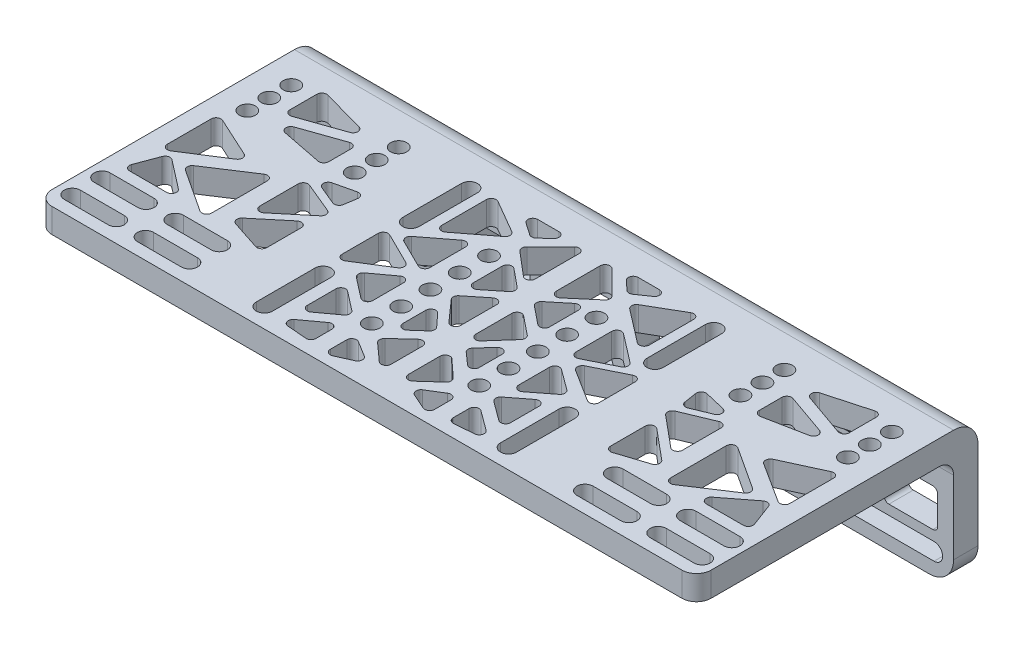
from build123d import *

# Parameters (mm, degrees)
SKETCH_1_W             = 135
SKETCH_1_H             = 70
EXTRUDE_1_DEPTH        = 5
CUT_EXTRUDE_1_DEPTH    = 77.198753271
CUT_EXTRUDE_2_DEPTH    = 77.198753271
SKETCH_4_R             = 1.65
CUT_EXTRUDE_3_DEPTH    = 77.198753271
CUT_EXTRUDE_8_DEPTH    = 77.198753271
CUT_EXTRUDE_9_DEPTH    = 77.198753271
SKETCH_14_R            = 1.65
CUT_EXTRUDE_11_DEPTH   = 77.198753271
CUT_EXTRUDE_12_DEPTH   = 77.198753271
FILLET_1_R             = 3
SKETCH_16_W            = 135
SKETCH_16_H            = 5
EXTRUDE_2_DEPTH        = 23
SKETCH_17_W            = 135
SKETCH_17_H            = 12.35
CUT_EXTRUDE_13_DEPTH   = 80.437082021
FILLET_2_R             = 5
RIB_3_REACH            = 81.437
SKETCH_19_WALL_W       = 168.684413718
SKETCH_19_WALL_H       = 2
PATTERN_LINEAR_1_COUNT = 3
PATTERN_LINEAR_1_PITCH = 23
PATTERN_LINEAR_2_COUNT = 3
PATTERN_LINEAR_2_PITCH = 23
CUT_EXTRUDE_14_DEPTH   = 92.699359322
FILLET_4_R             = 5
FILLET_5_R             = 3
CUT_EXTRUDE_17_DEPTH   = 92.699359322


with BuildPart() as part:
    # 草图1 → 凸台-拉伸1 (new body)
    with BuildSketch(Plane(origin=(0, 0, 0), x_dir=(1, 0, 0), z_dir=(0, 1, 0))):
        Rectangle(SKETCH_1_W, SKETCH_1_H)
    extrude(amount=EXTRUDE_1_DEPTH)

    # 草图2 → 切除-拉伸1 (cut, through all)
    with BuildSketch(Plane(origin=(0, 5, 0), x_dir=(1, 0, 0), z_dir=(0, 1, 0))):
        with BuildLine():
            Line((-64.5, -29.2), (-55.5, -29.2))
            ThreePointArc((-55.5, -29.2), (-53.85, -30.85), (-55.5, -32.5))
            Line((-55.5, -32.5), (-64.5, -32.5))
            ThreePointArc((-64.5, -32.5), (-66.15, -30.85), (-64.5, -29.2))
        make_face()
        with BuildLine():
            Line((-64.5, -23.1), (-55.5, -23.1))
            ThreePointArc((-55.5, -23.1), (-53.85, -24.75), (-55.5, -26.4))
            Line((-55.5, -26.4), (-64.5, -26.4))
            ThreePointArc((-64.5, -26.4), (-66.15, -24.75), (-64.5, -23.1))
        make_face()
        with BuildLine():
            Line((64.5, -29.2), (55.5, -29.2))
            ThreePointArc((55.5, -29.2), (53.85, -30.85), (55.5, -32.5))
            Line((55.5, -32.5), (64.5, -32.5))
            ThreePointArc((64.5, -32.5), (66.15, -30.85), (64.5, -29.2))
        make_face()
        with BuildLine():
            Line((64.5, -23.1), (55.5, -23.1))
            ThreePointArc((55.5, -23.1), (53.85, -24.75), (55.5, -26.4))
            Line((55.5, -26.4), (64.5, -26.4))
            ThreePointArc((64.5, -26.4), (66.15, -24.75), (64.5, -23.1))
        make_face()
        with BuildLine():
            Line((-40.5, -29.2), (-49.5, -29.2))
            ThreePointArc((-49.5, -29.2), (-51.15, -30.85), (-49.5, -32.5))
            Line((-49.5, -32.5), (-40.5, -32.5))
            ThreePointArc((-40.5, -32.5), (-38.85, -30.85), (-40.5, -29.2))
        make_face()
        with BuildLine():
            Line((-40.5, -23.1), (-49.5, -23.1))
            ThreePointArc((-49.5, -23.1), (-51.15, -24.75), (-49.5, -26.4))
            Line((-49.5, -26.4), (-40.5, -26.4))
            ThreePointArc((-40.5, -26.4), (-38.85, -24.75), (-40.5, -23.1))
        make_face()
        with BuildLine():
            Line((40.5, -29.2), (49.5, -29.2))
            ThreePointArc((49.5, -29.2), (51.15, -30.85), (49.5, -32.5))
            Line((49.5, -32.5), (40.5, -32.5))
            ThreePointArc((40.5, -32.5), (38.85, -30.85), (40.5, -29.2))
        make_face()
        with BuildLine():
            Line((40.5, -23.1), (49.5, -23.1))
            ThreePointArc((49.5, -23.1), (51.15, -24.75), (49.5, -26.4))
            Line((49.5, -26.4), (40.5, -26.4))
            ThreePointArc((40.5, -26.4), (38.85, -24.75), (40.5, -23.1))
        make_face()
    extrude(amount=-CUT_EXTRUDE_1_DEPTH, mode=Mode.SUBTRACT)

    # 草图3 → 切除-拉伸2 (cut, through all)
    with BuildSketch(Plane(origin=(0, 5, 0), x_dir=(1, 0, 0), z_dir=(0, 1, 0))):
        with BuildLine():
            Line((-23.35, 11), (-23.35, -1))
            ThreePointArc((-23.35, -1), (-25, -2.65), (-26.65, -1))
            Line((-26.65, -1), (-26.65, 11))
            ThreePointArc((-26.65, 11), (-25, 12.65), (-23.35, 11))
        make_face()
        with BuildLine():
            Line((23.35, 11), (23.35, -1))
            ThreePointArc((23.35, -1), (25, -2.65), (26.65, -1))
            Line((26.65, -1), (26.65, 11))
            ThreePointArc((26.65, 11), (25, 12.65), (23.35, 11))
        make_face()
        with BuildLine():
            Line((-23.35, -19), (-23.35, -31))
            ThreePointArc((-23.35, -31), (-25, -32.65), (-26.65, -31))
            Line((-26.65, -31), (-26.65, -19))
            ThreePointArc((-26.65, -19), (-25, -17.35), (-23.35, -19))
        make_face()
        with BuildLine():
            Line((23.35, -19), (23.35, -31))
            ThreePointArc((23.35, -31), (25, -32.65), (26.65, -31))
            Line((26.65, -31), (26.65, -19))
            ThreePointArc((26.65, -19), (25, -17.35), (23.35, -19))
        make_face()
    extrude(amount=-CUT_EXTRUDE_2_DEPTH, mode=Mode.SUBTRACT)

    # 草图4 → 切除-拉伸3 (cut, through all)
    with BuildSketch(Plane(origin=(0, 5, 0), x_dir=(1, 0, 0), z_dir=(0, 1, 0))):
        with Locations((-11, 1)):
            Circle(SKETCH_4_R)
        with Locations((11, 1)):
            Circle(SKETCH_4_R)
        with Locations((-11, -5)):
            Circle(SKETCH_4_R)
        with Locations((11, -5)):
            Circle(SKETCH_4_R)
        with Locations((-11, -11)):
            Circle(SKETCH_4_R)
        with Locations((11, -11)):
            Circle(SKETCH_4_R)
        with Locations((-11, -17)):
            Circle(SKETCH_4_R)
        with Locations((11, -17)):
            Circle(SKETCH_4_R)
        with Locations((-11, -23)):
            Circle(SKETCH_4_R)
        with Locations((11, -23)):
            Circle(SKETCH_4_R)
    extrude(amount=-CUT_EXTRUDE_3_DEPTH, mode=Mode.SUBTRACT)

    # 草图12 → 切除-拉伸8 (cut, through all)
    with BuildSketch(Plane(origin=(0, 5, 0), x_dir=(1, 0, 0), z_dir=(0, 1, 0))):
        with BuildLine():
            Line((-63.734074102, -3.168348006), (-63.734074102, -12.14560188))
            ThreePointArc((-63.734074102, -12.14560188), (-63.21431058, -13.022740937), (-62.195328252, -12.988070223))
            Line((-62.195328252, -12.988070223), (-54.02462453, -7.763027929))
            ThreePointArc((-54.02462453, -7.763027929), (-53.565765363, -6.851391459), (-54.146044292, -6.011802778))
            Line((-54.146044292, -6.011802778), (-62.316748014, -2.259591197))
            ThreePointArc((-62.316748014, -2.259591197), (-63.273830488, -2.32652674), (-63.734074102, -3.168348006))
        make_face()
        with BuildLine():
            Line((-57.235078223, -13.25409941), (-48.532404413, -7.570519551))
            ThreePointArc((-48.532404413, -7.570519551), (-47.509578035, -7.528348866), (-46.985601953, -8.4077812))
            Line((-46.985601953, -8.4077812), (-46.985601953, -19.824018357))
            ThreePointArc((-46.985601953, -19.824018357), (-47.511312771, -20.704387468), (-48.535701497, -20.659117448))
            Line((-48.535701497, -20.659117448), (-57.238375307, -14.926460151))
            ThreePointArc((-57.238375307, -14.926460151), (-57.68827382, -14.089389549), (-57.235078223, -13.25409941))
        make_face()
        with BuildLine():
            Line((-60.531869256, -14.412045599), (-54.642348672, -18.971490406))
            ThreePointArc((-54.642348672, -18.971490406), (-54.308267633, -20.085695031), (-55.254506416, -20.762226074))
            Line((-55.254506416, -20.762226074), (-62.853164133, -20.762226074))
            ThreePointArc((-62.853164133, -20.762226074), (-63.675053896, -20.331872646), (-63.789537506, -19.411220509))
            Line((-63.789537506, -19.411220509), (-62.080400373, -14.851775702))
            ThreePointArc((-62.080400373, -14.851775702), (-61.417192855, -14.240814315), (-60.531869256, -14.412045599))
        make_face()
        with BuildLine():
            Line((-43.29797533, -5.780567657), (-43.29797533, -13.662208286))
            ThreePointArc((-43.29797533, -13.662208286), (-42.722215702, -14.567757902), (-41.657935117, -14.430549698))
            Line((-41.657935117, -14.430549698), (-35.350215945, -9.176122612))
            ThreePointArc((-35.350215945, -9.176122612), (-35.001477233, -8.258395003), (-35.605765824, -7.484652183))
            Line((-35.605765824, -7.484652183), (-41.913484996, -4.85743864))
            ThreePointArc((-41.913484996, -4.85743864), (-42.852731883, -4.948554937), (-43.29797533, -5.780567657))
        make_face()
        with BuildLine():
            Line((-40.194472515, -4.039861777), (-36.374746493, -5.630807039))
            ThreePointArc((-36.374746493, -5.630807039), (-35.502130215, -5.580451224), (-35.002439657, -4.863301153))
            Line((-35.002439657, -4.863301153), (-34.594757613, -2.275542844))
            ThreePointArc((-34.594757613, -2.275542844), (-34.902588219, -1.386694522), (-35.812077839, -1.14661193))
            Line((-35.812077839, -1.14661193), (-40.039485904, -2.143424976))
            ThreePointArc((-40.039485904, -2.143424976), (-40.806659314, -3.035279156), (-40.194472515, -4.039861777))
        make_face()
        with BuildLine():
            Line((-42.939836308, -17.557072792), (-36.840451839, -12.476191717))
            ThreePointArc((-36.840451839, -12.476191717), (-35.776171254, -12.338983513), (-35.200411626, -13.244533129))
            Line((-35.200411626, -13.244533129), (-35.200411626, -20.314431761))
            ThreePointArc((-35.200411626, -20.314431761), (-35.613058655, -21.12376265), (-36.510444601, -21.265157565))
            Line((-36.510444601, -21.265157565), (-42.60982907, -19.276140007))
            ThreePointArc((-42.60982907, -19.276140007), (-43.281864213, -18.513940623), (-42.939836308, -17.557072792))
        make_face()
    cut_extrude_8 = extrude(amount=-CUT_EXTRUDE_8_DEPTH, mode=Mode.SUBTRACT)

    # 草图13 → 切除-拉伸9 (cut, through all)
    with BuildSketch(Plane(origin=(0, 5, 0), x_dir=(1, 0, 0), z_dir=(0, 1, 0))):
        with BuildLine():
            Line((-26.32841963, -6.356579512), (-26.32841963, -13.778151031))
            ThreePointArc((-26.32841963, -13.778151031), (-25.811643201, -14.653648022), (-24.795429669, -14.624272595))
            Line((-24.795429669, -14.624272595), (-18.204243774, -10.472344473))
            ThreePointArc((-18.204243774, -10.472344473), (-17.738524726, -9.575426115), (-18.292843888, -8.730389407))
            Line((-18.292843888, -8.730389407), (-24.884029783, -5.46074601))
            ThreePointArc((-24.884029783, -5.46074601), (-25.855491804, -5.506758988), (-26.32841963, -6.356579512))
        make_face()
        with BuildLine():
            Line((-22.215274528, -5.18562129), (-16.406548914, -8.067115098))
            ThreePointArc((-16.406548914, -8.067115098), (-15.435086893, -8.02110212), (-14.962159067, -7.171281596))
            Line((-14.962159067, -7.171281596), (-14.962159067, 0.175289238))
            ThreePointArc((-14.962159067, 0.175289238), (-15.520253308, 1.072350719), (-16.571597668, 0.968122506))
            Line((-16.571597668, 0.968122506), (-22.380323281, -3.496954519))
            ThreePointArc((-22.380323281, -3.496954519), (-22.766142167, -4.387063349), (-22.215274528, -5.18562129))
        make_face()
        with BuildLine():
            Line((-19.634017925, 0.752073679), (-12.851890732, 5.965389358))
            ThreePointArc((-12.851890732, 5.965389358), (-12.463407657, 6.822661193), (-12.95891763, 7.622851148))
            Line((-12.95891763, 7.622851148), (-19.741044823, 11.563757538))
            ThreePointArc((-19.741044823, 11.563757538), (-20.742249217, 11.565850339), (-21.243456526, 10.699129016))
            Line((-21.243456526, 10.699129016), (-21.243456526, 1.544906947))
            ThreePointArc((-21.243456526, 1.544906947), (-20.685362284, 0.647845467), (-19.634017925, 0.752073679))
        make_face()
        with BuildLine():
            Line((-20.745433527, -14.806594091), (-16.554551135, -11.725049957))
            ThreePointArc((-16.554551135, -11.725049957), (-15.510712541, -11.638401604), (-14.962159067, -12.53069978))
            Line((-14.962159067, -12.53069978), (-14.962159067, -18.8711078))
            ThreePointArc((-14.962159067, -18.8711078), (-15.522760117, -19.769399825), (-16.576016193, -19.660524944))
            Line((-16.576016193, -19.660524944), (-20.766898585, -16.401661059))
            ThreePointArc((-20.766898585, -16.401661059), (-21.152950924, -15.598787981), (-20.745433527, -14.806594091))
        make_face()
        with BuildLine():
            Line((-19.202554479, -19.757164414), (-15.332427174, -22.766606561))
            ThreePointArc((-15.332427174, -22.766606561), (-14.946374836, -23.569479639), (-15.353892232, -24.361673529))
            Line((-15.353892232, -24.361673529), (-19.224019538, -27.207367343))
            ThreePointArc((-19.224019538, -27.207367343), (-20.267858132, -27.294015695), (-20.816411606, -26.40171752))
            Line((-20.816411606, -26.40171752), (-20.816411606, -20.546581558))
            ThreePointArc((-20.816411606, -20.546581558), (-20.255810555, -19.648289533), (-19.202554479, -19.757164414))
        make_face()
        with BuildLine():
            Line((-19.659893025, -30.254964755), (-15.649320454, -27.306001929))
            ThreePointArc((-15.649320454, -27.306001929), (-14.60548186, -27.219353576), (-14.056928386, -28.111651752))
            Line((-14.056928386, -28.111651752), (-14.056928386, -31.393281697))
            ThreePointArc((-14.056928386, -31.393281697), (-14.379677934, -32.129034254), (-15.139592036, -32.3898592))
            Line((-15.139592036, -32.3898592), (-19.150164607, -32.057192082))
            ThreePointArc((-19.150164607, -32.057192082), (-20.029753985, -31.332770985), (-19.659893025, -30.254964755))
        make_face()
        with BuildLine():
            Line((-12.468613943, 12.436767394), (-8.104090394, 12.436767394))
            ThreePointArc((-8.104090394, 12.436767394), (-7.173170525, 11.801990884), (-7.424102786, 10.70354379))
            Line((-7.424102786, 10.70354379), (-9.29060424, 8.972560427))
            ThreePointArc((-9.29060424, 8.972560427), (-9.899764852, 8.708295416), (-10.540153983, 8.883835751))
            Line((-10.540153983, 8.883835751), (-13.038176078, 10.614819114))
            ThreePointArc((-13.038176078, 10.614819114), (-13.423063596, 11.73513941), (-12.468613943, 12.436767394))
        make_face()
        with BuildLine():
            Line((-8.728754124, 6.458240862), (-3.863914498, 11.323080487))
            ThreePointArc((-3.863914498, 11.323080487), (-2.774124285, 11.539853238), (-2.156807717, 10.615973706))
            Line((-2.156807717, 10.615973706), (-2.156807717, 1.616020399))
            ThreePointArc((-2.156807717, 1.616020399), (-2.737074719, 0.708372774), (-3.804456137, 0.854081081))
            Line((-3.804456137, 0.854081081), (-8.669295763, 4.989194763))
            ThreePointArc((-8.669295763, 4.989194763), (-9.02082927, 5.710693062), (-8.728754124, 6.458240862))
        make_face()
        with BuildLine():
            Line((-6.182358886, 1.291004241), (-2.539617647, -1.703452539))
            ThreePointArc((-2.539617647, -1.703452539), (-2.174649246, -2.481048805), (-2.547529137, -3.254882426))
            Line((-2.547529137, -3.254882426), (-6.190270376, -6.18759783))
            ThreePointArc((-6.190270376, -6.18759783), (-7.249171932, -6.310636828), (-7.817377482, -5.408664793))
            Line((-7.817377482, -5.408664793), (-7.817377482, 0.518507392))
            ThreePointArc((-7.817377482, 0.518507392), (-7.244566787, 1.4226696), (-6.182358886, 1.291004241))
        make_face()
        with BuildLine():
            Line((-7.000451718, -9.168133167), (-3.174636244, -6.088027489))
            ThreePointArc((-3.174636244, -6.088027489), (-2.115734688, -5.964988491), (-1.547529137, -6.866960526))
            Line((-1.547529137, -6.866960526), (-1.547529137, -14.261554286))
            ThreePointArc((-1.547529137, -14.261554286), (-2.192711099, -15.196489663), (-3.295737457, -14.925018158))
            Line((-3.295737457, -14.925018158), (-7.121552931, -10.610530077))
            ThreePointArc((-7.121552931, -10.610530077), (-7.369838636, -9.863402246), (-7.000451718, -9.168133167))
        make_face()
        with BuildLine():
            Line((-7.817377482, -15.115418128), (-7.817377482, -19.802251493))
            ThreePointArc((-7.817377482, -19.802251493), (-7.227582387, -20.714244879), (-6.15391361, -20.550459814))
            Line((-6.15391361, -20.550459814), (-3.776003869, -18.441879673))
            ThreePointArc((-3.776003869, -18.441879673), (-3.440726503, -17.743830497), (-3.704377843, -17.015701706))
            Line((-3.704377843, -17.015701706), (-6.082287584, -14.437448481))
            ThreePointArc((-6.082287584, -14.437448481), (-7.181321229, -14.183997198), (-7.817377482, -15.115418128))
        make_face()
        with BuildLine():
            Line((-7.011793916, -24.33986995), (-3.463727746, -21.067506696))
            ThreePointArc((-3.463727746, -21.067506696), (-2.384491135, -20.886635447), (-1.785758099, -21.802596594))
            Line((-1.785758099, -21.802596594), (-1.785758099, -28.278108515))
            ThreePointArc((-1.785758099, -28.278108515), (-2.379622001, -29.191921116), (-3.455865038, -29.020373083))
            Line((-3.455865038, -29.020373083), (-7.003931209, -25.817224416))
            ThreePointArc((-7.003931209, -25.817224416), (-7.333810107, -25.080281925), (-7.011793916, -24.33986995))
        make_face()
        with BuildLine():
            Line((-10.673294277, -28.46206955), (-10.673294277, -31.841222964))
            ThreePointArc((-10.673294277, -31.841222964), (-10.217120529, -32.6804208), (-9.264788262, -32.753978592))
            Line((-9.264788262, -32.753978592), (-6.085716299, -31.331177154))
            ThreePointArc((-6.085716299, -31.331177154), (-5.496361384, -30.483794028), (-5.970124889, -29.56676321))
            Line((-5.970124889, -29.56676321), (-9.149196851, -27.610411233))
            ThreePointArc((-9.149196851, -27.610411233), (-10.161096785, -27.589115535), (-10.673294277, -28.46206955))
        make_face()
    cut_extrude_9 = extrude(amount=-CUT_EXTRUDE_9_DEPTH, mode=Mode.SUBTRACT)

    # 镜向1: 切除-拉伸8, 切除-拉伸9 across plane
    add(cut_extrude_8.mirror(Plane(origin=(0, 0, 0), x_dir=(0, 0, 1), z_dir=(1, 0, 0))), mode=Mode.SUBTRACT)
    add(cut_extrude_9.mirror(Plane(origin=(0, 0, 0), x_dir=(0, 0, 1), z_dir=(1, 0, 0))), mode=Mode.SUBTRACT)

    # 草图14 → 切除-拉伸11 (cut, through all)
    with BuildSketch(Plane(origin=(0, 5, 0), x_dir=(1, 0, 0), z_dir=(0, 1, 0))):
        with Locations((-61.5, 11)):
            Circle(SKETCH_14_R)
        with Locations((-39.5, 11)):
            Circle(SKETCH_14_R)
        with Locations((39.5, 11)):
            Circle(SKETCH_14_R)
        with Locations((61.5, 11)):
            Circle(SKETCH_14_R)
        with Locations((-61.5, 6.5)):
            Circle(SKETCH_14_R)
        with Locations((-39.5, 6.5)):
            Circle(SKETCH_14_R)
        with Locations((39.5, 6.5)):
            Circle(SKETCH_14_R)
        with Locations((61.5, 6.5)):
            Circle(SKETCH_14_R)
        with Locations((-61.5, 2)):
            Circle(SKETCH_14_R)
        with Locations((-39.5, 2)):
            Circle(SKETCH_14_R)
        with Locations((39.5, 2)):
            Circle(SKETCH_14_R)
        with Locations((61.5, 2)):
            Circle(SKETCH_14_R)
    cut_extrude_11 = extrude(amount=-CUT_EXTRUDE_11_DEPTH, mode=Mode.SUBTRACT)

    # 草图15 → 切除-拉伸12 (cut, through all)
    with BuildSketch(Plane(origin=(0, 5, 0), x_dir=(1, 0, 0), z_dir=(0, 1, 0))):
        with BuildLine():
            Line((-57.28499066, 12.033394137), (-57.28499066, 6.477518919))
            ThreePointArc((-57.28499066, 6.477518919), (-56.863294329, 5.661697329), (-55.953860927, 5.533933681))
            Line((-55.953860927, 5.533933681), (-47.104970096, 8.639250233))
            ThreePointArc((-47.104970096, 8.639250233), (-46.436666563, 9.616497741), (-47.169210975, 10.546562786))
            Line((-47.169210975, 10.546562786), (-56.018101806, 12.997121453))
            ThreePointArc((-56.018101806, 12.997121453), (-56.890428991, 12.829286358), (-57.28499066, 12.033394137))
        make_face()
        with BuildLine():
            Line((-53.839725327, 3.87155111), (-45.426641576, 6.823931099))
            ThreePointArc((-45.426641576, 6.823931099), (-44.517208174, 6.696167452), (-44.095511844, 5.880345862))
            Line((-44.095511844, 5.880345862), (-44.095511844, 1.261805032))
            ThreePointArc((-44.095511844, 1.261805032), (-44.46079571, 0.489059647), (-45.289782704, 0.280857106))
            Line((-45.289782704, 0.280857106), (-53.702866455, 1.947017947))
            ThreePointArc((-53.702866455, 1.947017947), (-54.506076632, 2.857032239), (-53.839725327, 3.87155111))
        make_face()
    cut_extrude_12 = extrude(amount=-CUT_EXTRUDE_12_DEPTH, mode=Mode.SUBTRACT)

    # 镜向2: 切除-拉伸11, 切除-拉伸12 across plane
    add(cut_extrude_11.mirror(Plane(origin=(0, 0, 0), x_dir=(0, 0, 1), z_dir=(1, 0, 0))), mode=Mode.SUBTRACT)
    add(cut_extrude_12.mirror(Plane(origin=(0, 0, 0), x_dir=(0, 0, 1), z_dir=(1, 0, 0))), mode=Mode.SUBTRACT)

    # 圆角1
    fillet_1_edges = [part.edges().sort_by_distance(p)[0] for p in [
        (67.5, 2.5, 35),
        (-67.5, 2.5, 35),
    ]]
    fillet(fillet_1_edges, radius=FILLET_1_R)

    # 草图16 → 凸台-拉伸2 (add)
    with BuildSketch(Plane.XZ):
        with Locations((0, -20.15)):
            Rectangle(SKETCH_16_W, SKETCH_16_H)
    extrude(amount=EXTRUDE_2_DEPTH)

    # 草图17 → 切除-拉伸13 (cut, through all)
    with BuildSketch(Plane.XZ):
        with Locations((0, -28.825)):
            Rectangle(SKETCH_17_W, SKETCH_17_H)
    extrude(amount=-CUT_EXTRUDE_13_DEPTH, mode=Mode.SUBTRACT)

    # 圆角2
    fillet_2_edges = [part.edges().sort_by_distance(p)[0] for p in [
        (0, 5, -22.65),
    ]]
    fillet(fillet_2_edges, radius=FILLET_2_R)

    # 草图19 wall → 筋3 (add, up to next)
    with BuildSketch(Plane(origin=(0, -3, -15.15), x_dir=(0, -0.768221279597, -0.640184399664), z_dir=(0, 0.640184399664, -0.768221279597)), mode=Mode.PRIVATE) as rib_3_sk1:
        Rectangle(SKETCH_19_WALL_W, SKETCH_19_WALL_H)
    rib_3_tool1 = extrude(rib_3_sk1.sketch, amount=RIB_3_REACH, mode=Mode.PRIVATE) - part.part
    rib_3 = rib_3_tool1.solids().sort_by_distance((0, -3, -15.15))[0]
    add(rib_3)

    # 阵列(线性)1: 筋3 ×3
    with Locations(*[(i * PATTERN_LINEAR_1_PITCH, 0, 0) for i in range(1, PATTERN_LINEAR_1_COUNT)]):
        add(rib_3)

    # 阵列(线性)2: 筋3 ×3
    with Locations(*[(-i * PATTERN_LINEAR_2_PITCH, 0, 0) for i in range(1, PATTERN_LINEAR_2_COUNT)]):
        add(rib_3)

    # 草图20 → 切除-拉伸14 (cut, through all)
    with BuildSketch(Plane(origin=(0, 0, -22.65), x_dir=(-1, 0, 0), z_dir=(0, 0, -1))):
        with BuildLine():
            Line((-63.5, -16.75), (-41.5, -16.75))
            ThreePointArc((-41.5, -16.75), (-39.75, -18.5), (-41.5, -20.25))
            Line((-41.5, -20.25), (-63.5, -20.25))
            ThreePointArc((-63.5, -20.25), (-65.25, -18.5), (-63.5, -16.75))
        make_face()
        with BuildLine():
            Line((-26, -16.75), (-4, -16.75))
            ThreePointArc((-4, -16.75), (-2.25, -18.5), (-4, -20.25))
            Line((-4, -20.25), (-26, -20.25))
            ThreePointArc((-26, -20.25), (-27.75, -18.5), (-26, -16.75))
        make_face()
        with BuildLine():
            Line((63.5, -16.75), (41.5, -16.75))
            ThreePointArc((41.5, -16.75), (39.75, -18.5), (41.5, -20.25))
            Line((41.5, -20.25), (63.5, -20.25))
            ThreePointArc((63.5, -20.25), (65.25, -18.5), (63.5, -16.75))
        make_face()
        with BuildLine():
            Line((26, -16.75), (4, -16.75))
            ThreePointArc((4, -16.75), (2.25, -18.5), (4, -20.25))
            Line((4, -20.25), (26, -20.25))
            ThreePointArc((26, -20.25), (27.75, -18.5), (26, -16.75))
        make_face()
    extrude(amount=-CUT_EXTRUDE_14_DEPTH, mode=Mode.SUBTRACT)

    # 圆角4
    fillet_4_edges = [part.edges().sort_by_distance(p)[0] for p in [
        (-67.5, -23, -20.15),
        (67.5, -23, -20.15),
    ]]
    fillet(fillet_4_edges, radius=FILLET_4_R)

    # 圆角5
    fillet_5_edges = [part.edges().sort_by_distance(p)[0] for p in [
        (57.25, 0, -17.65),
        (34.5, 0, -17.65),
        (11.5, 0, -17.65),
        (-11.5, 0, -17.65),
        (-34.5, 0, -17.65),
        (-57.25, 0, -17.65),
    ]]
    fillet(fillet_5_edges, radius=FILLET_5_R)

    # 草图23 → 切除-拉伸17 (cut, through all)
    with BuildSketch(Plane(origin=(0, 0, -22.65), x_dir=(-1, 0, 0), z_dir=(0, 0, -1))):
        with BuildLine():
            Line((-3.25, -7), (-12.25, -7))
            ThreePointArc((-12.25, -7), (-12.957106781, -7.292893219), (-13.25, -8))
            Line((-13.25, -8), (-13.25, -13.75))
            ThreePointArc((-13.25, -13.75), (-12.957106781, -14.457106781), (-12.25, -14.75))
            Line((-12.25, -14.75), (-3.25, -14.75))
            ThreePointArc((-3.25, -14.75), (-2.542893219, -14.457106781), (-2.25, -13.75))
            Line((-2.25, -13.75), (-2.25, -8))
            ThreePointArc((-2.25, -8), (-2.542893219, -7.292893219), (-3.25, -7))
        make_face()
        with BuildLine():
            Line((-20.25, -7), (-29.25, -7))
            ThreePointArc((-29.25, -7), (-29.957106781, -7.292893219), (-30.25, -8))
            Line((-30.25, -8), (-30.25, -13.75))
            ThreePointArc((-30.25, -13.75), (-29.957106781, -14.457106781), (-29.25, -14.75))
            Line((-29.25, -14.75), (-20.25, -14.75))
            ThreePointArc((-20.25, -14.75), (-19.542893219, -14.457106781), (-19.25, -13.75))
            Line((-19.25, -13.75), (-19.25, -8))
            ThreePointArc((-19.25, -8), (-19.542893219, -7.292893219), (-20.25, -7))
        make_face()
        with BuildLine():
            Line((-37.25, -7), (-46.25, -7))
            ThreePointArc((-46.25, -7), (-46.957106781, -7.292893219), (-47.25, -8))
            Line((-47.25, -8), (-47.25, -13.75))
            ThreePointArc((-47.25, -13.75), (-46.957106781, -14.457106781), (-46.25, -14.75))
            Line((-46.25, -14.75), (-37.25, -14.75))
            ThreePointArc((-37.25, -14.75), (-36.542893219, -14.457106781), (-36.25, -13.75))
            Line((-36.25, -13.75), (-36.25, -8))
            ThreePointArc((-36.25, -8), (-36.542893219, -7.292893219), (-37.25, -7))
        make_face()
        with BuildLine():
            Line((-54.25, -7), (-63.25, -7))
            ThreePointArc((-63.25, -7), (-63.957106781, -7.292893219), (-64.25, -8))
            Line((-64.25, -8), (-64.25, -13.75))
            ThreePointArc((-64.25, -13.75), (-63.957106781, -14.457106781), (-63.25, -14.75))
            Line((-63.25, -14.75), (-54.25, -14.75))
            ThreePointArc((-54.25, -14.75), (-53.542893219, -14.457106781), (-53.25, -13.75))
            Line((-53.25, -13.75), (-53.25, -8))
            ThreePointArc((-53.25, -8), (-53.542893219, -7.292893219), (-54.25, -7))
        make_face()
        with BuildLine():
            Line((64.25, -8), (64.25, -13.75))
            ThreePointArc((64.25, -13.75), (63.957106781, -14.457106781), (63.25, -14.75))
            Line((63.25, -14.75), (54.25, -14.75))
            ThreePointArc((54.25, -14.75), (53.542893219, -14.457106781), (53.25, -13.75))
            Line((53.25, -13.75), (53.25, -8))
            ThreePointArc((53.25, -8), (53.542893219, -7.292893219), (54.25, -7))
            Line((54.25, -7), (63.25, -7))
            ThreePointArc((63.25, -7), (63.957106781, -7.292893219), (64.25, -8))
        make_face()
        with BuildLine():
            Line((47.25, -8), (47.25, -13.75))
            ThreePointArc((47.25, -13.75), (46.957106781, -14.457106781), (46.25, -14.75))
            Line((46.25, -14.75), (37.25, -14.75))
            ThreePointArc((37.25, -14.75), (36.542893219, -14.457106781), (36.25, -13.75))
            Line((36.25, -13.75), (36.25, -8))
            ThreePointArc((36.25, -8), (36.542893219, -7.292893219), (37.25, -7))
            Line((37.25, -7), (46.25, -7))
            ThreePointArc((46.25, -7), (46.957106781, -7.292893219), (47.25, -8))
        make_face()
        with BuildLine():
            Line((30.25, -8), (30.25, -13.75))
            ThreePointArc((30.25, -13.75), (29.957106781, -14.457106781), (29.25, -14.75))
            Line((29.25, -14.75), (20.25, -14.75))
            ThreePointArc((20.25, -14.75), (19.542893219, -14.457106781), (19.25, -13.75))
            Line((19.25, -13.75), (19.25, -8))
            ThreePointArc((19.25, -8), (19.542893219, -7.292893219), (20.25, -7))
            Line((20.25, -7), (29.25, -7))
            ThreePointArc((29.25, -7), (29.957106781, -7.292893219), (30.25, -8))
        make_face()
        with BuildLine():
            Line((13.25, -8), (13.25, -13.75))
            ThreePointArc((13.25, -13.75), (12.957106781, -14.457106781), (12.25, -14.75))
            Line((12.25, -14.75), (3.25, -14.75))
            ThreePointArc((3.25, -14.75), (2.542893219, -14.457106781), (2.25, -13.75))
            Line((2.25, -13.75), (2.25, -8))
            ThreePointArc((2.25, -8), (2.542893219, -7.292893219), (3.25, -7))
            Line((3.25, -7), (12.25, -7))
            ThreePointArc((12.25, -7), (12.957106781, -7.292893219), (13.25, -8))
        make_face()
    extrude(amount=-CUT_EXTRUDE_17_DEPTH, mode=Mode.SUBTRACT)


solid = part.part
